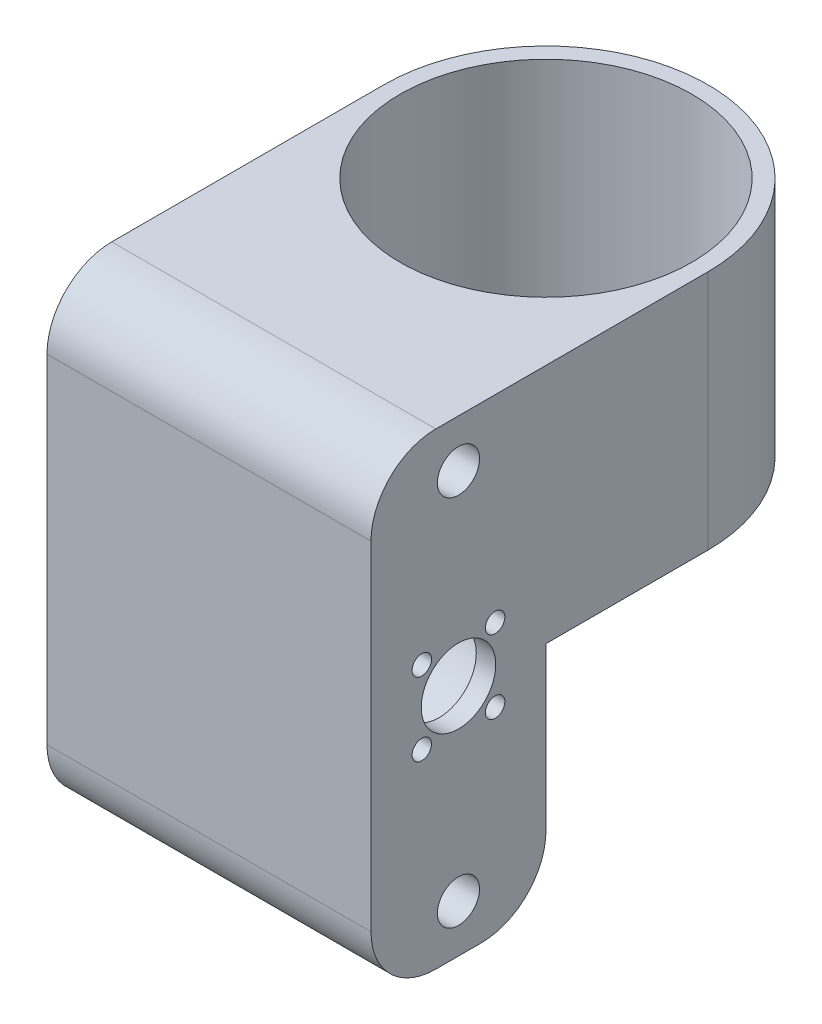
from build123d import *

# Parameters (mm, degrees)
SKETCH1_W           = 27
SKETCH1_H           = 72.2
SKETCH1_R           = 11
SKETCH1_R_2         = 3.25
SKETCH1_R_3         = 5.75
SKETCH1_R_4         = 1.5
BOSS_EXTRUDE1_DEPTH = 50
BOSS_EXTRUDE3_DEPTH = 72.2
CUT_EXTRUDE2_DEPTH  = 35
SKETCH1_3_R         = 11
SKETCH1_3_R_2       = 5.75
SKETCH1_3_R_3       = 1.5
CUT_EXTRUDE1_DEPTH  = 47
SKETCH3_R           = 22.5
SKETCH3_R_2         = 10
SKETCH3_R_3         = 2
CUT_EXTRUDE3_DEPTH  = 37.2
SKETCH3_6_R         = 22.5
SKETCH3_6_R_2       = 2
SKETCH3_6_R_3       = 10
BOSS_EXTRUDE4_DEPTH = 5
FILLET1_R           = 10


# Read off the part's stored shape, not the designer's step: Cut-Extrude2
with BuildPart() as part:
    # Sketch1 → Boss-Extrude1 (new body)
    # profile 1 of 2: a face of its own
    with BuildSketch(Plane(origin=(0, 0, 0), x_dir=(0, 0, -1), z_dir=(1, 0, 0))):
        Rectangle(SKETCH1_W, SKETCH1_H)
        Circle(SKETCH1_R, mode=Mode.SUBTRACT)
        with Locations((0, -28.75)):
            Circle(SKETCH1_R_2, mode=Mode.SUBTRACT)
        with Locations((0, 28.75)):
            Circle(SKETCH1_R_2, mode=Mode.SUBTRACT)
    # profile 2 of 2: a face of its own
    with BuildSketch(Plane(origin=(0, 0, 0), x_dir=(0, 0, -1), z_dir=(1, 0, 0))):
        Circle(SKETCH1_R)
        Circle(SKETCH1_R_3, mode=Mode.SUBTRACT)
        with Locations((-5.656854249, 5.656854249)):
            Circle(SKETCH1_R_4, mode=Mode.SUBTRACT)
        with Locations((5.656854249, 5.656854249)):
            Circle(SKETCH1_R_4, mode=Mode.SUBTRACT)
        with Locations((5.656854249, -5.656854249)):
            Circle(SKETCH1_R_4, mode=Mode.SUBTRACT)
        with Locations((-5.656854249, -5.656854249)):
            Circle(SKETCH1_R_4, mode=Mode.SUBTRACT)
    extrude(amount=BOSS_EXTRUDE1_DEPTH)

    # Sketch2 → Boss-Extrude3 (add)
    with BuildSketch(Plane(origin=(0, -36.1, 0), x_dir=(1, 0, 0), z_dir=(0, 1, 0))):
        with BuildLine():
            Line((0, 13.5), (25, 13.5))
            ThreePointArc((25, 13.5), (7.32233047, 20.82233047), (0, 38.5))
            Line((0, 38.5), (0, 13.5))
        make_face()
        with BuildLine():
            ThreePointArc((25, 13.5), (42.67766953, 20.82233047), (50, 38.5))
            Line((50, 38.5), (0, 38.5))
            ThreePointArc((0, 38.5), (7.32233047, 20.82233047), (25, 13.5))
        make_face()
        with BuildLine():
            Line((25, 13.5), (50, 13.5))
            Line((50, 13.5), (50, 38.5))
            ThreePointArc((50, 38.5), (42.67766953, 20.82233047), (25, 13.5))
        make_face()
        with BuildLine():
            Line((0, 38.5), (50, 38.5))
            ThreePointArc((50, 38.5), (25, 63.5), (0, 38.5))
        make_face()
    extrude(amount=BOSS_EXTRUDE3_DEPTH)

    # Cut-Extrude2 outline → Cut-Extrude2 (cut)
    with BuildSketch(Plane(origin=(0, -36.1, 0), x_dir=(1, 0, 0), z_dir=(0, 1, 0))):
        with BuildLine():
            Line((0, 13.5), (50, 13.5))
            Line((50, 13.5), (50, 38.5))
            ThreePointArc((50, 38.5), (25, 63.5), (0, 38.5))
            Line((0, 38.5), (0, 13.5))
        make_face()
    extrude(amount=CUT_EXTRUDE2_DEPTH, mode=Mode.SUBTRACT)

    # Sketch1<3> → Cut-Extrude1 (cut)
    with BuildSketch(Plane(origin=(0, 0, 0), x_dir=(0, 0, -1), z_dir=(1, 0, 0))):
        Circle(SKETCH1_3_R)
        Circle(SKETCH1_3_R_2, mode=Mode.SUBTRACT)
        with Locations((-5.656854249, 5.656854249)):
            Circle(SKETCH1_3_R_3, mode=Mode.SUBTRACT)
        with Locations((5.656854249, 5.656854249)):
            Circle(SKETCH1_3_R_3, mode=Mode.SUBTRACT)
        with Locations((5.656854249, -5.656854249)):
            Circle(SKETCH1_3_R_3, mode=Mode.SUBTRACT)
        with Locations((-5.656854249, -5.656854249)):
            Circle(SKETCH1_3_R_3, mode=Mode.SUBTRACT)
    extrude(amount=CUT_EXTRUDE1_DEPTH, mode=Mode.SUBTRACT)

    # Sketch3 → Cut-Extrude3 (cut)
    # profile 1 of 6: a face of its own
    with BuildSketch(Plane.XZ.offset(1.1)):
        with Locations(Location((25, -38.5, 0), (0, 0, 270))):
            Circle(SKETCH3_R)
        with Locations((25, -38.5)):
            Circle(SKETCH3_R_2, mode=Mode.SUBTRACT)
        with Locations((15, -48.5)):
            Circle(SKETCH3_R_3, mode=Mode.SUBTRACT)
        with Locations((35, -48.5)):
            Circle(SKETCH3_R_3, mode=Mode.SUBTRACT)
        with Locations((35, -28.5)):
            Circle(SKETCH3_R_3, mode=Mode.SUBTRACT)
        with Locations((15, -28.5)):
            Circle(SKETCH3_R_3, mode=Mode.SUBTRACT)
    # profile 2 of 6: a face of its own
    with BuildSketch(Plane.XZ.offset(1.1)):
        with Locations((25, -38.5)):
            Circle(SKETCH3_R_2)
    # profile 3 of 6: a face of its own
    with BuildSketch(Plane.XZ.offset(1.1)):
        with Locations((35, -28.5)):
            Circle(SKETCH3_R_3)
    # profile 4 of 6: a face of its own
    with BuildSketch(Plane.XZ.offset(1.1)):
        with Locations((15, -28.5)):
            Circle(SKETCH3_R_3)
    # profile 5 of 6: a face of its own
    with BuildSketch(Plane.XZ.offset(1.1)):
        with Locations((15, -48.5)):
            Circle(SKETCH3_R_3)
    # profile 6 of 6: a face of its own
    with BuildSketch(Plane.XZ.offset(1.1)):
        with Locations((35, -48.5)):
            Circle(SKETCH3_R_3)
    extrude(amount=-CUT_EXTRUDE3_DEPTH, mode=Mode.SUBTRACT)

    # Sketch3<6> → Boss-Extrude4 (add)
    with BuildSketch(Plane.XZ.offset(1.1)):
        with Locations(Location((25, -38.5, 0), (0, 0, 270))):
            Circle(SKETCH3_6_R)
        with Locations(Location((15, -28.5, 0), (0, 0, 270))):
            Circle(SKETCH3_6_R_2, mode=Mode.SUBTRACT)
        with Locations(Location((35, -28.5, 0), (0, 0, 270))):
            Circle(SKETCH3_6_R_2, mode=Mode.SUBTRACT)
        with Locations(Location((35, -48.5, 0), (0, 0, 270))):
            Circle(SKETCH3_6_R_2, mode=Mode.SUBTRACT)
        with Locations(Location((15, -48.5, 0), (0, 0, 270))):
            Circle(SKETCH3_6_R_2, mode=Mode.SUBTRACT)
        with Locations(Location((25, -38.5, 0), (0, 0, 270))):
            Circle(SKETCH3_6_R_3, mode=Mode.SUBTRACT)
    extrude(amount=-BOSS_EXTRUDE4_DEPTH)

    # Fillet1
    fillet1_edges = [part.edges().sort_by_distance(p)[0] for p in [
        (25, 36.1, 13.5),
        (25, -36.1, 13.5),
        (25, -36.1, -13.5),
    ]]
    fillet(fillet1_edges, radius=FILLET1_R)


solid = part.part
